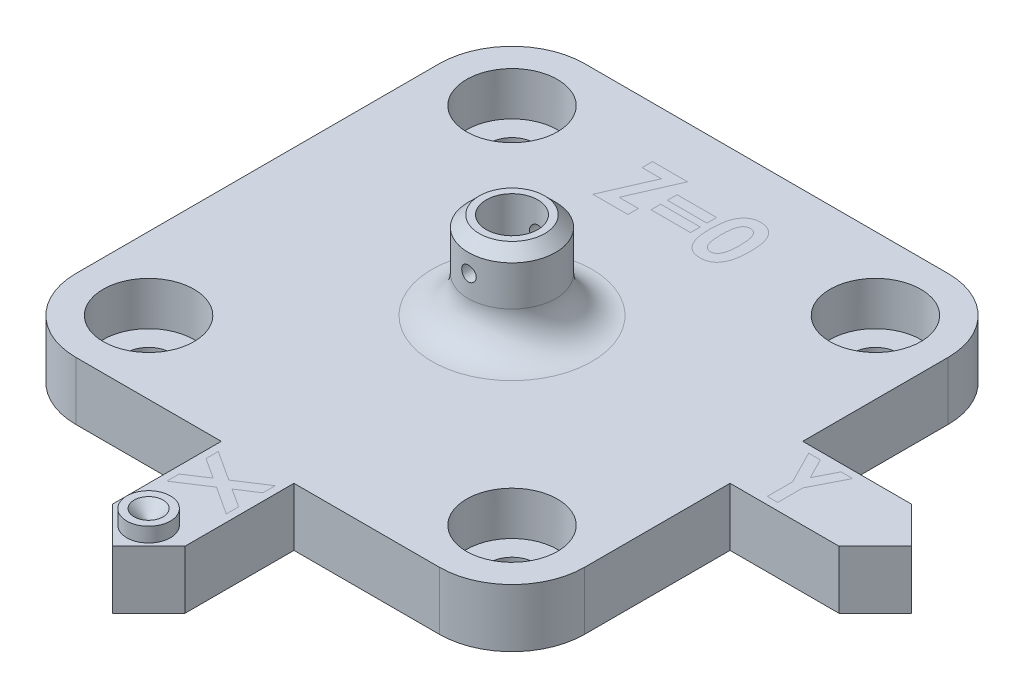
from build123d import *

# Parameters (mm, degrees)
SKETCH1_W               = 70
SKETCH1_H               = 70
BOSS_EXTRUDE1_DEPTH     = 8
SKETCH2_R               = 3.1
CUT_EXTRUDE1_DEPTH      = 51.139804547
SKETCH8_R               = 6.25
CUT_EXTRUDE6_DEPTH      = 6
LPATTERN1_COUNT         = 2
LPATTERN1_PITCH         = 50
LPATTERN1_COUNT_DIR2    = 2
LPATTERN1_PITCH_DIR2    = 50
SKETCH3_R               = 6
BOSS_EXTRUDE2_DEPTH     = 12
SKETCH4_R               = 3.55
CUT_EXTRUDE2_DEPTH      = 11
SKETCH5_R               = 3.05
CUT_EXTRUDE3_DEPTH      = 51.705029336
FILLET1_R               = 5
CUT_EXTRUDE5_DEPTH      = 54.38539126
CUT_EXTRUDE5_DEPTH_BACK = 54.38539126
SKETCH7_R               = 1
CHAMFER2_SIZE           = 1.5
SKETCH9_W               = 10
SKETCH9_H               = 20
SKETCH9_W_2             = 20
SKETCH9_H_2             = 10
BOSS_EXTRUDE3_DEPTH     = 8
CHAMFER3_SIZE           = 5
SKETCH10_W              = 5.435897436
SKETCH10_H              = 1.333333334
SKETCH10_H_2            = 1.333333333
CUT_EXTRUDE7_DEPTH      = 1
BOSS_EXTRUDE5_DEPTH     = 1
BOSS_EXTRUDE5_2_DEPTH   = 1
BOSS_EXTRUDE5_3_DEPTH   = 1
SKETCH16_W              = 5.435897436
SKETCH16_H              = 1.333333333
BOSS_EXTRUDE5_4_DEPTH   = 1
SKETCH16_H_2            = 1.333333334
BOSS_EXTRUDE5_5_DEPTH   = 1
BOSS_EXTRUDE5_6_DEPTH   = 1
SKETCH12_R              = 3
BOSS_EXTRUDE4_DEPTH     = 2
SKETCH13_R              = 2
CUT_EXTRUDE8_DEPTH      = 2
CHAMFER4_SIZE           = 2
FILLET2_R               = 10


with BuildPart() as part:
    # Sketch1 → Boss-Extrude1 (new body)
    with BuildSketch(Plane(origin=(0, 0, 0), x_dir=(1, 0, 0), z_dir=(0, 1, 0))):
        Rectangle(SKETCH1_W, SKETCH1_H)
    extrude(amount=BOSS_EXTRUDE1_DEPTH)

    # Sketch2 → Cut-Extrude1 (cut, through all)
    with BuildSketch(Plane(origin=(0, 8, 0), x_dir=(1, 0, 0), z_dir=(0, 1, 0))):
        with Locations(Location((-25, 25, 0), (0, 0, 270))):
            Circle(SKETCH2_R)
    cut_extrude1 = extrude(amount=-CUT_EXTRUDE1_DEPTH, mode=Mode.SUBTRACT)

    # Sketch8 → Cut-Extrude6 (cut)
    with BuildSketch(Plane(origin=(0, 8, 0), x_dir=(1, 0, 0), z_dir=(0, 1, 0))):
        with Locations(Location((-25, 25, 0), (0, 0, 270))):
            Circle(SKETCH8_R)
    cut_extrude6 = extrude(amount=-CUT_EXTRUDE6_DEPTH, mode=Mode.SUBTRACT)

    # LPattern1: Cut-Extrude1, Cut-Extrude6 2 × 2
    with Locations(*[(i * LPATTERN1_PITCH, 0, j * LPATTERN1_PITCH_DIR2) for i in range(LPATTERN1_COUNT) for j in range(LPATTERN1_COUNT_DIR2) if (i, j) != (0, 0)]):
        add(cut_extrude1, mode=Mode.SUBTRACT)
        add(cut_extrude6, mode=Mode.SUBTRACT)

    # Sketch3 → Boss-Extrude2 (add)
    with BuildSketch(Plane(origin=(0, 8, 0), x_dir=(1, 0, 0), z_dir=(0, 1, 0))):
        with Locations(Location((0, 0, 0), (0, 0, 90))):
            Circle(SKETCH3_R)
    extrude(amount=BOSS_EXTRUDE2_DEPTH)

    # Sketch4 → Cut-Extrude2 (cut)
    with BuildSketch(Plane(origin=(0, 20, 0), x_dir=(1, 0, 0), z_dir=(0, 1, 0))):
        with Locations(Location((0, 0, 0), (0, 0, 270))):
            Circle(SKETCH4_R)
    extrude(amount=-CUT_EXTRUDE2_DEPTH, mode=Mode.SUBTRACT)

    # Sketch5 → Cut-Extrude3 (cut, through all)
    with BuildSketch(Plane(origin=(0, 9, 0), x_dir=(1, 0, 0), z_dir=(0, 1, 0))):
        with Locations(Location((0, 0, 0), (0, 0, 270))):
            Circle(SKETCH5_R)
    extrude(amount=-CUT_EXTRUDE3_DEPTH, mode=Mode.SUBTRACT)

    # Fillet1
    fillet1_edges = [part.edges().sort_by_distance(p)[0] for p in [
        (0, 8, 6),
    ]]
    fillet(fillet1_edges, radius=FILLET1_R)

    # Sketch7 → Cut-Extrude5 (cut, two sides: drawn at the far end of the back side and taken through both)
    with BuildSketch(Plane(origin=(0, 0, 0), x_dir=(-1, 0, 0), z_dir=(0, 0, -1)).offset(-CUT_EXTRUDE5_DEPTH_BACK)):
        with Locations((0, 16)):
            Circle(SKETCH7_R)
    extrude(amount=CUT_EXTRUDE5_DEPTH + CUT_EXTRUDE5_DEPTH_BACK, mode=Mode.SUBTRACT)

    # Chamfer2
    chamfer2_edges = [part.edges().sort_by_distance(p)[0] for p in [
        (0, 20, 6),
    ]]
    chamfer(chamfer2_edges, length=CHAMFER2_SIZE)

    # Sketch9 → Boss-Extrude3 (add)
    with BuildSketch(Plane(origin=(0, 0, 0), x_dir=(1, 0, 0), z_dir=(0, 1, 0))):
        with Locations((0, -45)):
            Rectangle(SKETCH9_W, SKETCH9_H)
        with Locations((45, 0)):
            Rectangle(SKETCH9_W_2, SKETCH9_H_2)
    extrude(amount=BOSS_EXTRUDE3_DEPTH)

    # Chamfer3
    chamfer3_edges = [part.edges().sort_by_distance(p)[0] for p in [
        (55, 4, -5),
        (55, 4, 5),
        (5, 4, 55),
        (-5, 4, 55),
    ]]
    chamfer(chamfer3_edges, length=CHAMFER3_SIZE - 0.0001)  # a hair under: the kernel refuses the full size

    # Sketch10 → Cut-Extrude7 (cut)
    # profile 1 of 6: a face of its own
    with BuildSketch(Plane(origin=(0, 8, 0), x_dir=(1, 0, 0), z_dir=(0, 1, 0))):
        Polygon((4, -43.309294872), (4, -41.616987179), (1.431089744, -39.945512821), (4, -38.270833333), (4, -36.573717949), (0.129807692, -39.09775641), (-4, -36.41025641), (-4, -38.102564103), (-1.168269231, -39.945512821), (-4, -41.791666667), (-4, -43.487179487), (0.133012821, -40.791666667), align=None)
    # profile 2 of 6: a face of its own
    with BuildSketch(Plane(origin=(0, 8, 0), x_dir=(1, 0, 0), z_dir=(0, 1, 0))):
        Polygon((36.820512821, 4), (38.418269231, 4), (39.846153846, 1.192307692), (41.27724359, 4), (42.871794872, 4), (40.564102564, -0.53525641), (40.564102564, -4), (39.128205128, -4), (39.128205128, -0.53525641), align=None)
    # profile 3 of 6: a face of its own
    with BuildSketch(Plane(origin=(0, 8, 0), x_dir=(1, 0, 0), z_dir=(0, 1, 0))):
        Polygon((-8.666666667, 28), (-3.846153846, 28), (-6.709935897, 21.435897436), (-4.051282051, 21.435897436), (-4.051282051, 20), (-8.871794872, 20), (-6.009615385, 26.564102564), (-8.666666667, 26.564102564), align=None)
    # profile 4 of 6: a face of its own
    with BuildSketch(Plane(origin=(0, 8, 0), x_dir=(1, 0, 0), z_dir=(0, 1, 0))):
        with Locations((-0.307692308, 25.076923077)):
            Rectangle(SKETCH10_W, SKETCH10_H)
    # profile 5 of 6: a face of its own
    with BuildSketch(Plane(origin=(0, 8, 0), x_dir=(1, 0, 0), z_dir=(0, 1, 0))):
        with Locations((-0.307692308, 22.82051282)):
            Rectangle(SKETCH10_W, SKETCH10_H_2)
    # profile 6 of 6: a face of its own
    with BuildSketch(Plane(origin=(0, 8, 0), x_dir=(1, 0, 0), z_dir=(0, 1, 0))):
        with BuildLine():
            add(Edge.make_bspline(
                [(6.02724359, 28.205128205), (6.096746985, 28.204096408), (6.233409231, 28.202067618), (6.434686994, 28.180094175), (6.62857313, 28.14689843), (6.815826145, 28.100601941), (6.995098173, 28.039330188), (7.167693993, 27.96598895), (7.331559215, 27.876731327), (7.488783644, 27.775910258), (7.639306718, 27.661766515), (7.779510719, 27.531636755), (7.911956071, 27.388515269), (8.033775819, 27.230238316), (8.147667699, 27.058245593), (8.253257481, 26.872509828), (8.34973685, 26.672121968), (8.438187108, 26.456720398), (8.517279608, 26.223076341), (8.583899123, 25.968509798), (8.641036505, 25.692962635), (8.689264486, 25.395748974), (8.725717045, 25.076473745), (8.750286804, 24.735349061), (8.767147735, 24.373032558), (8.768523807, 24.124486414), (8.769230769, 23.996794872)],
                knots=[0, 0, 0, 0, 0.879237366, 1.728815576, 2.559023295, 3.367336655, 4.166867292, 4.954216142, 5.737608147, 6.525189134, 7.316157332, 8.124696809, 8.942788509, 9.781158001, 10.649253743, 11.551476218, 12.482711956, 13.461909668, 14.496590415, 15.601789533, 16.789733467, 18.056700938, 19.410929216, 20.8549011, 22.384193279, 24, 24, 24, 24], degree=3))
            add(Edge.make_bspline(
                [(8.769230769, 23.996794872), (8.768466734, 23.867505765), (8.766982228, 23.616299348), (8.750987718, 23.250668915), (8.723444416, 22.90706746), (8.687944621, 22.585530532), (8.639319612, 22.28622793), (8.582372968, 22.00838466), (8.514701884, 21.752101434), (8.433004102, 21.517955714), (8.345089235, 21.302175851), (8.248345954, 21.1021787), (8.144460481, 20.917422557), (8.035815635, 20.745120125), (7.916455106, 20.590350792), (7.792188508, 20.447851591), (7.65760505, 20.323050499), (7.518371218, 20.209515829), (7.369386312, 20.11139909), (7.212186775, 20.025587807), (7.043970011, 19.955984665), (6.867802326, 19.89544757), (6.680680907, 19.851988467), (6.485579087, 19.817505098), (6.280294206, 19.798447473), (6.14052799, 19.796083249), (6.068910256, 19.794871795)],
                knots=[0, 0, 0, 0, 1.643780988, 3.193836972, 4.651895693, 6.025988579, 7.305620092, 8.505800249, 9.631074763, 10.672816429, 11.65661981, 12.592235626, 13.49536222, 14.350718032, 15.179365177, 15.97804903, 16.751647189, 17.51006938, 18.259804725, 19.016521909, 19.783502495, 20.571750527, 21.382245291, 22.22305063, 23.089471752, 24, 24, 24, 24], degree=3))
            add(Edge.make_bspline(
                [(6.068910256, 19.794871795), (5.997294455, 19.796106617), (5.857000154, 19.798525616), (5.651160163, 19.817363396), (5.455024401, 19.85212816), (5.266422551, 19.895781217), (5.086667251, 19.955850721), (4.914896581, 20.027536339), (4.752431308, 20.112812202), (4.598821591, 20.211157544), (4.454591899, 20.323932581), (4.317500901, 20.449931058), (4.187851852, 20.588833602), (4.067617034, 20.742196035), (3.95482735, 20.907971289), (3.850659018, 21.088052436), (3.75517464, 21.282177283), (3.665387447, 21.490616421), (3.587373741, 21.717857303), (3.517945165, 21.965929164), (3.461071103, 22.236899886), (3.415329175, 22.530682416), (3.378808847, 22.846654365), (3.35164192, 23.184968243), (3.335558568, 23.545781627), (3.33408963, 23.793786639), (3.333333333, 23.921474359)],
                knots=[0, 0, 0, 0, 0.917216111, 1.796812873, 2.643793957, 3.46689424, 4.273913431, 5.068098542, 5.848489301, 6.620921603, 7.401012384, 8.190319798, 9.003608147, 9.831726257, 10.68377682, 11.569763213, 12.493818149, 13.453288342, 14.474581811, 15.568529029, 16.750744269, 18.018426408, 19.375425659, 20.823733699, 22.36466933, 24, 24, 24, 24], degree=3))
            add(Edge.make_bspline(
                [(3.333333333, 23.921474359), (3.334703294, 24.098886394), (3.337346651, 24.441205201), (3.370845212, 24.935756347), (3.420012603, 25.392883214), (3.492227854, 25.811821139), (3.581521012, 26.194121748), (3.695865551, 26.537266643), (3.826038492, 26.846004004), (3.93696256, 27.028901876), (3.990384615, 27.116987179)],
                knots=[0, 0, 0, 0, 1.288568992, 2.486310467, 3.599230591, 4.627010532, 5.572937695, 6.447898582, 7.252493626, 8, 8, 8, 8], degree=3))
            add(Edge.make_bspline(
                [(3.990384615, 27.116987179), (4.052501237, 27.203522154), (4.173951472, 27.372715082), (4.386310603, 27.594833769), (4.614462841, 27.784800547), (4.863094301, 27.938316297), (5.128272775, 28.059378831), (5.412274955, 28.144883935), (5.714052067, 28.194703192), (5.921287444, 28.201601308), (6.02724359, 28.205128205)],
                knots=[0, 0, 0, 0, 1.058512271, 2.069600068, 3.047294572, 4.004278952, 4.967380941, 5.939006123, 6.946246673, 8, 8, 8, 8], degree=3))
        make_face()
        with BuildLine():
            add(Edge.make_bspline(
                [(6.0625, 26.769230769), (5.999668354, 26.766252674), (5.876484975, 26.760414027), (5.697740023, 26.710852149), (5.529194693, 26.634301157), (5.400986762, 26.542184006), (5.305024401, 26.45387867), (5.237974811, 26.373965213), (5.17331605, 26.284787554), (5.116206175, 26.182321565), (5.062279546, 26.070248969), (5.009576975, 25.948061023), (4.966374705, 25.812756529), (4.923929621, 25.666639737), (4.886743766, 25.505670908), (4.855590172, 25.328534299), (4.827757174, 25.134077975), (4.808343327, 24.922174565), (4.790243794, 24.693045773), (4.777269192, 24.44618119), (4.771844837, 24.181647414), (4.7701206, 23.999466928), (4.769230769, 23.905448718)],
                knots=[0, 0, 0, 0, 1.076674018, 2.110852608, 3.161083442, 4.239746716, 4.804137807, 5.395870207, 6.026861976, 6.692161227, 7.405688833, 8.16177676, 8.973626916, 9.841385931, 10.773283133, 11.807421078, 12.927755683, 14.143907515, 15.458935494, 16.872852025, 18.386167141, 20, 20, 20, 20], degree=3))
            add(Edge.make_bspline(
                [(4.769230769, 23.905448718), (4.770695322, 23.783643582), (4.773503711, 23.550073203), (4.788212737, 23.214190865), (4.81769576, 22.908510891), (4.854366688, 22.630961575), (4.905872504, 22.383342899), (4.965133279, 22.163312161), (5.038315067, 21.973674217), (5.122890724, 21.811686477), (5.216562075, 21.673883843), (5.318246447, 21.556750984), (5.424481852, 21.455319454), (5.538584242, 21.372927872), (5.660281402, 21.309786761), (5.788557386, 21.26437014), (5.923493711, 21.236568735), (6.015896715, 21.232713574), (6.0625, 21.230769231)],
                knots=[0, 0, 0, 0, 1.771748488, 3.397459088, 4.888034009, 6.237357457, 7.467047327, 8.564189669, 9.548206622, 10.417051504, 11.216568818, 11.965764335, 12.669334354, 13.348544111, 14.005342236, 14.656555988, 15.322436492, 16, 16, 16, 16], degree=3))
            add(Edge.make_bspline(
                [(6.0625, 21.230769231), (6.107504008, 21.232099695), (6.195616259, 21.234704578), (6.324103654, 21.261443357), (6.445610465, 21.304914804), (6.559769825, 21.366408218), (6.666990066, 21.444606501), (6.76674716, 21.539853292), (6.858288761, 21.653097979), (6.911621313, 21.737142284), (6.939102564, 21.780448718)],
                knots=[0, 0, 0, 0, 0.992283464, 1.942767638, 2.88273346, 3.832339453, 4.79467288, 5.803907806, 6.868395428, 8, 8, 8, 8], degree=3))
            add(Edge.make_bspline(
                [(6.939102564, 21.780448718), (6.971457108, 21.839625575), (7.039301964, 21.963714646), (7.117812148, 22.173110326), (7.183897645, 22.409274044), (7.240776466, 22.672940765), (7.27967811, 22.965150423), (7.313180158, 23.284050091), (7.329339028, 23.631245618), (7.331967356, 23.871783932), (7.333333333, 23.996794872)],
                knots=[0, 0, 0, 0, 0.710965849, 1.490837728, 2.352621235, 3.297892224, 4.334225155, 5.461620853, 6.680770821, 8, 8, 8, 8], degree=3))
            add(Edge.make_bspline(
                [(7.333333333, 23.996794872), (7.332805686, 24.122890967), (7.331790055, 24.365604424), (7.313156165, 24.714048143), (7.287207049, 25.032293652), (7.249250984, 25.319630437), (7.200413607, 25.576756025), (7.140221355, 25.803653609), (7.069259168, 26.00077036), (6.985106472, 26.167909726), (6.891902131, 26.309955258), (6.792962879, 26.431819307), (6.687870359, 26.535863758), (6.57680032, 26.622480147), (6.457182008, 26.688661565), (6.331300288, 26.735391121), (6.198897093, 26.763660935), (6.108579369, 26.767349098), (6.0625, 26.769230769)],
                knots=[0, 0, 0, 0, 1.793836731, 3.452829483, 4.963243077, 6.335886805, 7.574563692, 8.684454726, 9.672768357, 10.54971625, 11.340229787, 12.085688095, 12.778991901, 13.440269426, 14.083255152, 14.715733572, 15.344777694, 16, 16, 16, 16], degree=3))
        make_face(mode=Mode.SUBTRACT)
    extrude(amount=-CUT_EXTRUDE7_DEPTH, mode=Mode.SUBTRACT)

    # Sketch12 → Boss-Extrude4 (add)
    with BuildSketch(Plane(origin=(0, 8, 0), x_dir=(1, 0, 0), z_dir=(0, 1, 0))):
        with Locations(Location((0, -50, 0), (0, 0, 90))):
            Circle(SKETCH12_R)
    extrude(amount=BOSS_EXTRUDE4_DEPTH)

    # Sketch13 → Cut-Extrude8 (cut)
    with BuildSketch(Plane(origin=(0, 10, 0), x_dir=(1, 0, 0), z_dir=(0, 1, 0))):
        with Locations(Location((0, -50, 0), (0, 0, 270))):
            Circle(SKETCH13_R)
    extrude(amount=-CUT_EXTRUDE8_DEPTH, mode=Mode.SUBTRACT)

    # Chamfer4
    chamfer4_edges = [part.edges().sort_by_distance(p)[0] for p in [
        (0, 8, 48),
    ]]
    chamfer(chamfer4_edges, length=CHAMFER4_SIZE - 0.0001)  # a hair under: the kernel refuses the full size

    # Fillet2
    fillet2_edges = [part.edges().sort_by_distance(p)[0] for p in [
        (35, 4, 35),
        (-35, 4, 35),
        (-35, 4, -35),
        (35, 4, -35),
    ]]
    fillet(fillet2_edges, radius=FILLET2_R)


with BuildPart() as body_2:
    # Sketch16 → Boss-Extrude5 (new body)
    with BuildSketch(Plane(origin=(0, 7, 0), x_dir=(1, 0, 0), z_dir=(0, 1, 0))):
        Polygon((-8.666666667, 28), (-8.666666667, 26.564102564), (-6.009615385, 26.564102564), (-8.871794872, 20), (-4.051282051, 20), (-4.051282051, 21.435897436), (-6.709935897, 21.435897436), (-3.846153846, 28), align=None)
    extrude(amount=BOSS_EXTRUDE5_DEPTH)


with BuildPart() as body_3:
    # Sketch16 → Boss-Extrude5 2 (new body)
    with BuildSketch(Plane(origin=(0, 7, 0), x_dir=(1, 0, 0), z_dir=(0, 1, 0))):
        Polygon((0.133012821, -40.791666667), (4, -43.309294872), (4, -41.616987179), (1.431089744, -39.945512821), (4, -38.270833333), (4, -36.573717949), (0.129807692, -39.09775641), (-4, -36.41025641), (-4, -38.102564103), (-1.168269231, -39.945512821), (-4, -41.791666667), (-4, -43.487179487), align=None)
    extrude(amount=BOSS_EXTRUDE5_2_DEPTH)


with BuildPart() as body_4:
    # Sketch16 → Boss-Extrude5 3 (new body)
    with BuildSketch(Plane(origin=(0, 7, 0), x_dir=(1, 0, 0), z_dir=(0, 1, 0))):
        Polygon((36.820512821, 4), (39.128205128, -0.53525641), (39.128205128, -4), (40.564102564, -4), (40.564102564, -0.53525641), (42.871794872, 4), (41.27724359, 4), (39.846153846, 1.192307692), (38.418269231, 4), align=None)
    extrude(amount=BOSS_EXTRUDE5_3_DEPTH)


with BuildPart() as body_5:
    # Sketch16 → Boss-Extrude5 4 (new body)
    with BuildSketch(Plane(origin=(0, 7, 0), x_dir=(1, 0, 0), z_dir=(0, 1, 0))):
        with Locations((-0.307692308, 22.82051282)):
            Rectangle(SKETCH16_W, SKETCH16_H)
    extrude(amount=BOSS_EXTRUDE5_4_DEPTH)


with BuildPart() as body_6:
    # Sketch16 → Boss-Extrude5 5 (new body)
    with BuildSketch(Plane(origin=(0, 7, 0), x_dir=(1, 0, 0), z_dir=(0, 1, 0))):
        with Locations((-0.307692308, 25.076923077)):
            Rectangle(SKETCH16_W, SKETCH16_H_2)
    extrude(amount=BOSS_EXTRUDE5_5_DEPTH)


with BuildPart() as body_7:
    # Sketch16 → Boss-Extrude5 6 (new body)
    with BuildSketch(Plane(origin=(0, 7, 0), x_dir=(1, 0, 0), z_dir=(0, 1, 0))):
        with BuildLine():
            add(Edge.make_bspline(
                [(6.02724359, 28.205128205), (5.921287444, 28.201601308), (5.714052067, 28.194703192), (5.412274955, 28.144883935), (5.128272775, 28.059378831), (4.863094301, 27.938316297), (4.614462841, 27.784800547), (4.386310603, 27.594833769), (4.173951472, 27.372715082), (4.052501237, 27.203522154), (3.990384615, 27.116987179)],
                knots=[0, 0, 0, 0, 0.131719166, 0.257624235, 0.379077382, 0.499465131, 0.619088179, 0.741299991, 0.867685966, 1, 1, 1, 1], degree=3))
            add(Edge.make_bspline(
                [(3.990384615, 27.116987179), (3.93696256, 27.028901876), (3.826038492, 26.846004004), (3.695865551, 26.537266643), (3.581521012, 26.194121748), (3.492227854, 25.811821139), (3.420012603, 25.392883214), (3.370845212, 24.935756347), (3.337346651, 24.441205201), (3.334703294, 24.098886394), (3.333333333, 23.921474359)],
                knots=[0, 0, 0, 0, 0.093438297, 0.194012677, 0.303382788, 0.421623683, 0.550096176, 0.689211192, 0.838928876, 1, 1, 1, 1], degree=3))
            add(Edge.make_bspline(
                [(3.333333333, 23.921474359), (3.33408963, 23.793786639), (3.335558568, 23.545781627), (3.35164192, 23.184968243), (3.378808847, 22.846654365), (3.415329175, 22.530682416), (3.461071103, 22.236899886), (3.517945165, 21.965929164), (3.587373741, 21.717857303), (3.665387447, 21.490616421), (3.75517464, 21.282177283), (3.850659018, 21.088052436), (3.95482735, 20.907971289), (4.067617034, 20.742196035), (4.187851852, 20.588833602), (4.317500901, 20.449931058), (4.454591899, 20.323932581), (4.598821591, 20.211157544), (4.752431308, 20.112812202), (4.914896581, 20.027536339), (5.086667251, 19.955850721), (5.266422551, 19.895781217), (5.455024401, 19.85212816), (5.651160163, 19.817363396), (5.857000154, 19.798525616), (5.997294455, 19.796106617), (6.068910256, 19.794871795)],
                knots=[0, 0, 0, 0, 0.068138778, 0.132344429, 0.192690598, 0.249232233, 0.302052322, 0.35131129, 0.396892425, 0.439446319, 0.479424244, 0.517926533, 0.554842633, 0.590344739, 0.624849661, 0.658736675, 0.691624484, 0.724128267, 0.756312946, 0.788829227, 0.821920274, 0.855546073, 0.889841918, 0.925132797, 0.961782662, 1, 1, 1, 1], degree=3))
            add(Edge.make_bspline(
                [(6.068910256, 19.794871795), (6.14052799, 19.796083249), (6.280294206, 19.798447473), (6.485579087, 19.817505098), (6.680680907, 19.851988467), (6.867802326, 19.89544757), (7.043970011, 19.955984665), (7.212186775, 20.025587807), (7.369386312, 20.11139909), (7.518371218, 20.209515829), (7.65760505, 20.323050499), (7.792188508, 20.447851591), (7.916455106, 20.590350792), (8.035815635, 20.745120125), (8.144460481, 20.917422557), (8.248345954, 21.1021787), (8.345089235, 21.302175851), (8.433004102, 21.517955714), (8.514701884, 21.752101434), (8.582372968, 22.00838466), (8.639319612, 22.28622793), (8.687944621, 22.585530532), (8.723444416, 22.90706746), (8.750987718, 23.250668915), (8.766982228, 23.616299348), (8.768466734, 23.867505765), (8.769230769, 23.996794872)],
                knots=[0, 0, 0, 0, 0.037938677, 0.074039557, 0.109073113, 0.142843728, 0.175687396, 0.20764492, 0.239174803, 0.270413776, 0.3020147, 0.334247957, 0.367526451, 0.402053415, 0.437693241, 0.475323516, 0.514307508, 0.555299315, 0.598705218, 0.645591656, 0.695599163, 0.748917143, 0.806171013, 0.86692346, 0.931509126, 1, 1, 1, 1], degree=3))
            add(Edge.make_bspline(
                [(8.769230769, 23.996794872), (8.768523807, 24.124486414), (8.767147735, 24.373032558), (8.750286804, 24.735349061), (8.725717045, 25.076473745), (8.689264486, 25.395748974), (8.641036505, 25.692962635), (8.583899123, 25.968509798), (8.517279608, 26.223076341), (8.438187108, 26.456720398), (8.34973685, 26.672121968), (8.253257481, 26.872509828), (8.147667699, 27.058245593), (8.033775819, 27.230238316), (7.911956071, 27.388515269), (7.779510719, 27.531636755), (7.639306718, 27.661766515), (7.488783644, 27.775910258), (7.331559215, 27.876731327), (7.167693993, 27.96598895), (6.995098173, 28.039330188), (6.815826145, 28.100601941), (6.62857313, 28.14689843), (6.434686994, 28.180094175), (6.233409231, 28.202067618), (6.096746985, 28.204096408), (6.02724359, 28.205128205)],
                knots=[0, 0, 0, 0, 0.06732528, 0.131045787, 0.191211283, 0.247637461, 0.300427772, 0.349925436, 0.395975399, 0.439087097, 0.479887002, 0.518688491, 0.556281094, 0.59245175, 0.627383812, 0.661470966, 0.695160111, 0.728117119, 0.760932994, 0.793574327, 0.82638053, 0.859694306, 0.893374029, 0.927966018, 0.96336511, 1, 1, 1, 1], degree=3))
        make_face()
        with BuildLine():
            add(Edge.make_bspline(
                [(7.333333333, 23.996794872), (7.332805686, 24.122890967), (7.331790055, 24.365604424), (7.313156165, 24.714048143), (7.287207049, 25.032293652), (7.249250984, 25.319630437), (7.200413607, 25.576756025), (7.140221355, 25.803653609), (7.069259168, 26.00077036), (6.985106472, 26.167909726), (6.891902131, 26.309955258), (6.792962879, 26.431819307), (6.687870359, 26.535863758), (6.57680032, 26.622480147), (6.457182008, 26.688661565), (6.331300288, 26.735391121), (6.198897093, 26.763660935), (6.108579369, 26.767349098), (6.0625, 26.769230769)],
                knots=[0, 0, 0, 0, 0.112114796, 0.215801843, 0.310202692, 0.395992925, 0.473410231, 0.54277842, 0.604548022, 0.659357266, 0.708764362, 0.755355506, 0.798686994, 0.840016839, 0.880203447, 0.919733348, 0.959048606, 1, 1, 1, 1], degree=3))
            add(Edge.make_bspline(
                [(6.0625, 26.769230769), (5.999668354, 26.766252674), (5.876484975, 26.760414027), (5.697740023, 26.710852149), (5.529194693, 26.634301157), (5.400986762, 26.542184006), (5.305024401, 26.45387867), (5.237974811, 26.373965213), (5.17331605, 26.284787554), (5.116206175, 26.182321565), (5.062279546, 26.070248969), (5.009576975, 25.948061023), (4.966374705, 25.812756529), (4.923929621, 25.666639737), (4.886743766, 25.505670908), (4.855590172, 25.328534299), (4.827757174, 25.134077975), (4.808343327, 24.922174565), (4.790243794, 24.693045773), (4.777269192, 24.44618119), (4.771844837, 24.181647414), (4.7701206, 23.999466928), (4.769230769, 23.905448718)],
                knots=[0, 0, 0, 0, 0.053833701, 0.10554263, 0.158054172, 0.211987336, 0.24020689, 0.26979351, 0.301343099, 0.334608061, 0.370284442, 0.408088838, 0.448681346, 0.492069297, 0.538664157, 0.590371054, 0.646387784, 0.707195376, 0.772946775, 0.843642601, 0.919308357, 1, 1, 1, 1], degree=3))
            add(Edge.make_bspline(
                [(4.769230769, 23.905448718), (4.770695322, 23.783643582), (4.773503711, 23.550073203), (4.788212737, 23.214190865), (4.81769576, 22.908510891), (4.854366688, 22.630961575), (4.905872504, 22.383342899), (4.965133279, 22.163312161), (5.038315067, 21.973674217), (5.122890724, 21.811686477), (5.216562075, 21.673883843), (5.318246447, 21.556750984), (5.424481852, 21.455319454), (5.538584242, 21.372927872), (5.660281402, 21.309786761), (5.788557386, 21.26437014), (5.923493711, 21.236568735), (6.015896715, 21.232713574), (6.0625, 21.230769231)],
                knots=[0, 0, 0, 0, 0.11073428, 0.212341193, 0.305502126, 0.389834841, 0.466690458, 0.535261854, 0.596762914, 0.651065719, 0.701035551, 0.747860271, 0.791833397, 0.834284007, 0.87533389, 0.916034749, 0.957652281, 1, 1, 1, 1], degree=3))
            add(Edge.make_bspline(
                [(6.0625, 21.230769231), (6.107504008, 21.232099695), (6.195616259, 21.234704578), (6.324103654, 21.261443357), (6.445610465, 21.304914804), (6.559769825, 21.366408218), (6.666990066, 21.444606501), (6.76674716, 21.539853292), (6.858288761, 21.653097979), (6.911621313, 21.737142284), (6.939102564, 21.780448718)],
                knots=[0, 0, 0, 0, 0.124035433, 0.242845955, 0.360341682, 0.479042432, 0.59933411, 0.725488476, 0.858549429, 1, 1, 1, 1], degree=3))
            add(Edge.make_bspline(
                [(6.939102564, 21.780448718), (6.971457108, 21.839625575), (7.039301964, 21.963714646), (7.117812148, 22.173110326), (7.183897645, 22.409274044), (7.240776466, 22.672940765), (7.27967811, 22.965150423), (7.313180158, 23.284050091), (7.329339028, 23.631245618), (7.331967356, 23.871783932), (7.333333333, 23.996794872)],
                knots=[0, 0, 0, 0, 0.088870731, 0.186354716, 0.294077654, 0.412236528, 0.541778144, 0.682702607, 0.835096353, 1, 1, 1, 1], degree=3))
        make_face(mode=Mode.SUBTRACT)
    extrude(amount=BOSS_EXTRUDE5_6_DEPTH)


solid = Compound([part.part, body_2.part, body_3.part, body_4.part, body_5.part, body_6.part, body_7.part])
